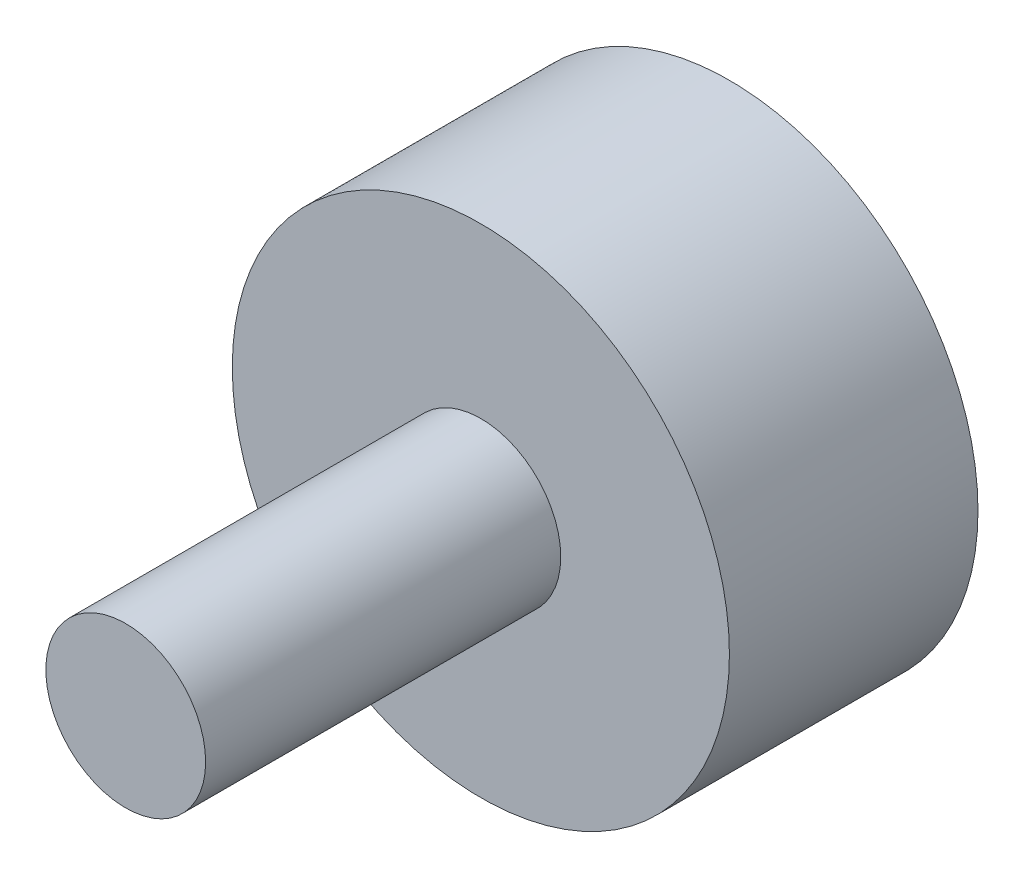
from build123d import *

# Parameters (mm, degrees)
SKETCH1_R           = 7
SKETCH1_R_2         = 4
BOSS_EXTRUDE1_DEPTH = 5
SKETCH2_R           = 7
BOSS_EXTRUDE2_DEPTH = 2
SKETCH3_R           = 2.25
BOSS_EXTRUDE3_DEPTH = 10
THREAD1_PITCH       = 1


with BuildPart() as part:
    # Sketch1 → Boss-Extrude1 (new body)
    with BuildSketch(Plane.XY):
        Circle(SKETCH1_R)
        Circle(SKETCH1_R_2, mode=Mode.SUBTRACT)
    extrude(amount=BOSS_EXTRUDE1_DEPTH)

    # Sketch2 → Boss-Extrude2 (add)
    with BuildSketch(Plane.XY.offset(5)):
        Circle(SKETCH2_R)
    extrude(amount=BOSS_EXTRUDE2_DEPTH)

    # Sketch3 → Boss-Extrude3 (add)
    with BuildSketch(Plane.XY.offset(7)):
        Circle(SKETCH3_R)
    extrude(amount=BOSS_EXTRUDE3_DEPTH)

    # Thread1: the profile of Thread Profile1 profile screwed along a right-hand helix of 5 turns, 8 arcs to a turn; built about Z, then put on its axis
    thread1_z = Axis((0, 0, 0), (0, 0, 1))
    thread1_corners = [(4.0003, 0, -0.000173205), (4.0003, 0, 0.875173202), (3.458734125, 0, 0.562499999), (3.458734125, 0, 0.312499999)]
    with BuildLine(mode=Mode.PRIVATE) as thread1_profile:
        Line(thread1_corners[0], thread1_corners[1])
        Line(thread1_corners[1], thread1_corners[2])
        Line(thread1_corners[2], thread1_corners[3])
        Line(thread1_corners[3], thread1_corners[0])
    thread1_cap = Face(thread1_profile.wire())
    thread1_turn_angles = [0, 22.5, 45, 67.5, 90, 112.5, 135, 157.5, 180, 202.5, 225, 247.5, 270, 292.5, 315, 337.5, 360]
    thread1_turn_weights = [1, 0.9238795325112867, 1, 0.9238795325112867, 1, 0.9238795325112867, 1, 0.9238795325112867, 1, 0.9238795325112867, 1, 0.9238795325112867, 1, 0.9238795325112867, 1, 0.9238795325112867, 1]
    thread1_turn_rails = [Edge.make_bspline([Vector(p[0], p[1], 0).rotate(thread1_z, thread1_turn_angles[k]) / thread1_turn_weights[k] + Vector(0, 0, p[2] + THREAD1_PITCH * thread1_turn_angles[k] / 360) for k in range(17)], [0, 0, 0, 1, 1, 2, 2, 3, 3, 4, 4, 5, 5, 6, 6, 7, 7, 8, 8, 8], 2, thread1_turn_weights) for p in thread1_corners]
    thread1_turn_sides = [Face.make_surface_from_curves(thread1_turn_rails[p[0]], thread1_turn_rails[p[1]]) for p in [(0, 1), (1, 2), (2, 3), (3, 0)]]
    thread1 = Plane(origin=(0, 0, 0), x_dir=(1, 0, 0), z_dir=(0, 0, 1)) * Solid(Shell([*[p.moved(Location((0, 0, THREAD1_PITCH * i))) for i in range(5) for p in thread1_turn_sides], thread1_cap, thread1_cap.rotate(thread1_z, 1800).moved(Location((0, 0, THREAD1_PITCH * 1800 / 360)))]))
    add(thread1)


solid = part.part
